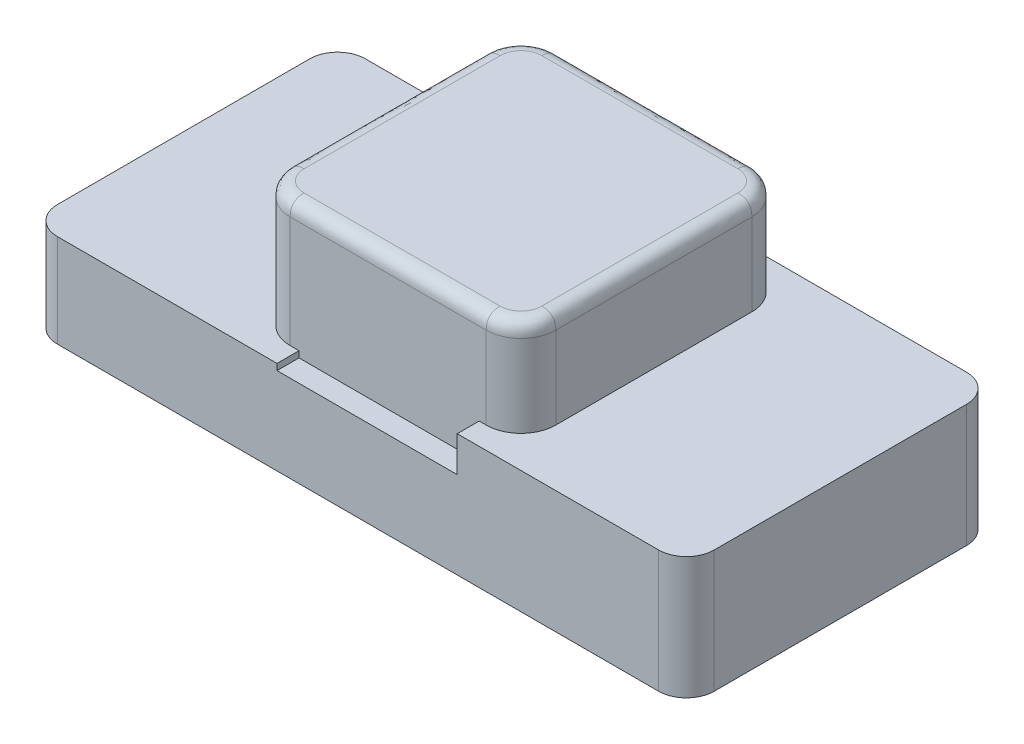
from build123d import *

# Parameters (mm, degrees)
BOSS_EXTRUDE1_DEPTH = 31.42
BOSS_EXTRUDE2_DEPTH = 13.4
BOSS_EXTRUDE3_DEPTH = 17.6
SKETCH1_5_W         = 25.92
SKETCH1_5_H         = 3.16
SKETCH1_5_H_2       = 2.93
BOSS_EXTRUDE4_DEPTH = 12.5
FILLET2_SIZE        = 2


with BuildPart() as part:
    # Sketch1 → Boss-Extrude1 (new body)
    with BuildSketch(Plane(origin=(0, 0, 0), x_dir=(1, 0, 0), z_dir=(0, 1, 0))):
        with BuildLine():
            Line((-12.92, 19.215), (15.28, 19.215))
            ThreePointArc((15.28, 19.215), (18.815533906, 17.750533906), (20.28, 14.215))
            Line((20.28, 14.215), (20.28, -13.985))
            ThreePointArc((20.28, -13.985), (18.815533906, -17.520533906), (15.28, -18.985))
            Line((15.28, -18.985), (-12.92, -18.985))
            ThreePointArc((-12.92, -18.985), (-16.455533906, -17.520533906), (-17.92, -13.985))
            Line((-17.92, -13.985), (-17.92, 14.215))
            ThreePointArc((-17.92, 14.215), (-16.455533906, 17.750533906), (-12.92, 19.215))
        make_face()
    extrude(amount=BOSS_EXTRUDE1_DEPTH)

    # Sketch1<3> → Boss-Extrude2 (add)
    with BuildSketch(Plane(origin=(0, 0, 0), x_dir=(1, 0, 0), z_dir=(0, 1, 0))):
        with BuildLine():
            Line((-43.23, -22.145), (-11.65, -22.145))
            Line((-11.65, -22.145), (-11.65, -18.985))
            Line((-11.65, -18.985), (-12.92, -18.985))
            ThreePointArc((-12.92, -18.985), (-16.455533906, -17.520533906), (-17.92, -13.985))
            Line((-17.92, -13.985), (-17.92, 14.215))
            ThreePointArc((-17.92, 14.215), (-16.455533906, 17.750533906), (-12.92, 19.215))
            Line((-12.92, 19.215), (-11.65, 19.215))
            Line((-11.65, 19.215), (-11.65, 22.145))
            Line((-11.65, 22.145), (-43.23, 22.145))
            ThreePointArc((-43.23, 22.145), (-46.058427125, 20.973427125), (-47.23, 18.145))
            Line((-47.23, 18.145), (-47.23, -18.145))
            ThreePointArc((-47.23, -18.145), (-46.058427125, -20.973427125), (-43.23, -22.145))
        make_face()
    extrude(amount=BOSS_EXTRUDE2_DEPTH)

    # Sketch1<4> → Boss-Extrude3 (add)
    with BuildSketch(Plane(origin=(0, 0, 0), x_dir=(1, 0, 0), z_dir=(0, 1, 0))):
        with BuildLine():
            Line((14.27, -18.985), (14.27, -22.145))
            Line((14.27, -22.145), (43.23, -22.145))
            ThreePointArc((43.23, -22.145), (46.058427125, -20.973427125), (47.23, -18.145))
            Line((47.23, -18.145), (47.23, 18.145))
            ThreePointArc((47.23, 18.145), (46.058427125, 20.973427125), (43.23, 22.145))
            Line((43.23, 22.145), (14.27, 22.145))
            Line((14.27, 22.145), (14.27, 19.215))
            Line((14.27, 19.215), (15.28, 19.215))
            ThreePointArc((15.28, 19.215), (18.815533906, 17.750533906), (20.28, 14.215))
            Line((20.28, 14.215), (20.28, -13.985))
            ThreePointArc((20.28, -13.985), (18.815533906, -17.520533906), (15.28, -18.985))
            Line((15.28, -18.985), (14.27, -18.985))
        make_face()
    extrude(amount=BOSS_EXTRUDE3_DEPTH)

    # Sketch1<5> → Boss-Extrude4 (add)
    with BuildSketch(Plane(origin=(0, 0, 0), x_dir=(1, 0, 0), z_dir=(0, 1, 0))):
        with Locations((1.31, -20.565)):
            Rectangle(SKETCH1_5_W, SKETCH1_5_H)
        with Locations((1.31, 20.68)):
            Rectangle(SKETCH1_5_W, SKETCH1_5_H_2)
    extrude(amount=BOSS_EXTRUDE4_DEPTH)

    # Fillet2
    # a fillet whose section is not a circle: 2 mm, written as the material it takes off along each edge
    with BuildSketch(Plane(origin=(-17.92, 31.42, 13.985), x_dir=(0, -1, 0), z_dir=(0, 0, -1)), Plane(origin=(-12.92, 31.42, -19.215), x_dir=(0, -1, 0), z_dir=(1, 0, 0)), Plane(origin=(20.28, 31.42, -14.215), x_dir=(0, -1, 0), z_dir=(0, 0, 1)), Plane(origin=(15.28, 31.42, 18.985), x_dir=(0, -1, 0), z_dir=(-1, 0, 0))) as fillet2_piece_1:
        with BuildLine():
            Bezier((FILLET2_SIZE, 0), (0, 0), (0, -FILLET2_SIZE), weights=[1, 1, 1])
            Line((0, -FILLET2_SIZE), (0, 0))
            Line((0, 0), (FILLET2_SIZE, 0))
        make_face()
    extrude(amount=28.2, mode=Mode.SUBTRACT)
    with BuildSketch(Plane(origin=(-12.92, 31.42, -14.215), x_dir=(-1, 0, 0), z_dir=(0, 0, 1))) as fillet2_piece_2:
        with BuildLine():
            Bezier((5, FILLET2_SIZE), (5, 0), (5 - FILLET2_SIZE, 0), weights=[1, 1, 1])
            Line((5 - FILLET2_SIZE, 0), (5, 0))
            Line((5, 0), (5, FILLET2_SIZE))
        make_face()
    revolve(axis=Axis((-12.92, 31.42, -14.215), (0, -1, 0)), revolution_arc=90, mode=Mode.SUBTRACT)
    with BuildSketch(Plane(origin=(15.28, 31.42, -14.215), x_dir=(0, 0, -1), z_dir=(-1, 0, 0))) as fillet2_piece_3:
        with BuildLine():
            Bezier((5 - FILLET2_SIZE, 0), (5, 0), (5, FILLET2_SIZE), weights=[1, 1, 1])
            Line((5, FILLET2_SIZE), (5, 0))
            Line((5, 0), (5 - FILLET2_SIZE, 0))
        make_face()
    revolve(axis=Axis((15.28, 31.42, -14.215), (0, -1, 0)), revolution_arc=90, mode=Mode.SUBTRACT)
    with BuildSketch(Plane(origin=(15.28, 31.42, 13.985), x_dir=(1, 0, 0), z_dir=(0, 0, -1))) as fillet2_piece_4:
        with BuildLine():
            Bezier((5, FILLET2_SIZE), (5, 0), (5 - FILLET2_SIZE, 0), weights=[1, 1, 1])
            Line((5 - FILLET2_SIZE, 0), (5, 0))
            Line((5, 0), (5, FILLET2_SIZE))
        make_face()
    revolve(axis=Axis((15.28, 31.42, 13.985), (0, -1, 0)), revolution_arc=90, mode=Mode.SUBTRACT)
    with BuildSketch(Plane(origin=(-12.92, 31.42, 13.985), x_dir=(0, 0, 1), z_dir=(1, 0, 0))) as fillet2_piece_5:
        with BuildLine():
            Bezier((5, FILLET2_SIZE), (5, 0), (5 - FILLET2_SIZE, 0), weights=[1, 1, 1])
            Line((5 - FILLET2_SIZE, 0), (5, 0))
            Line((5, 0), (5, FILLET2_SIZE))
        make_face()
    revolve(axis=Axis((-12.92, 31.42, 13.985), (0, -1, 0)), revolution_arc=90, mode=Mode.SUBTRACT)


solid = part.part
